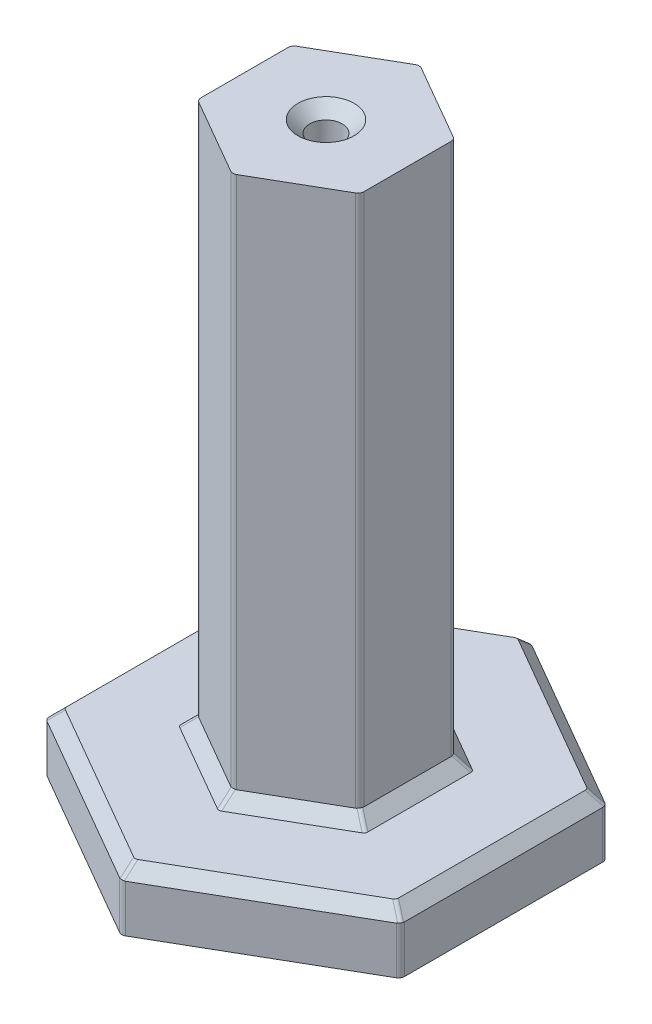
from build123d import *

# Parameters (mm, degrees)
BOSS_EXTRUDE1_DEPTH = 51
BOSS_EXTRUDE2_DEPTH = 5
SKETCH5_R           = 1.375
CUT_EXTRUDE2_DEPTH  = 15
CHAMFER1_SIZE       = 1
FILLET2_R           = 0.5


with BuildPart() as part:
    # Sketch2 → Boss-Extrude1 (new body)
    with BuildSketch(Plane(origin=(0, 0, 0), x_dir=(1, 0, 0), z_dir=(0, 1, 0))):
        Polygon((-6.875, 3.969283101), (-6.875, -3.969283101), (0, -7.938566201), (6.875, -3.969283101), (6.875, 3.969283101), (0, 7.938566201), align=None)
    extrude(amount=BOSS_EXTRUDE1_DEPTH)

    # Sketch2<3> → Boss-Extrude2 (add)
    with BuildSketch(Plane(origin=(0, 0, 0), x_dir=(1, 0, 0), z_dir=(0, 1, 0))):
        Polygon((0, -17.320508076), (15, -8.660254038), (15, 8.660254038), (0, 17.320508076), (-15, 8.660254038), (-15, -8.660254038), align=None)
        Polygon((0, -7.938566201), (6.875, -3.969283101), (6.875, 3.969283101), (0, 7.938566201), (-6.875, 3.969283101), (-6.875, -3.969283101), align=None, mode=Mode.SUBTRACT)
    extrude(amount=BOSS_EXTRUDE2_DEPTH)

    # Sketch5 → Cut-Extrude2 (cut)
    with BuildSketch(Plane(origin=(0, 51, 0), x_dir=(1, 0, 0), z_dir=(0, 1, 0))):
        with Locations(Location((0, 0, 0), (0, 0, 270))):
            Circle(SKETCH5_R)
    extrude(amount=-CUT_EXTRUDE2_DEPTH, mode=Mode.SUBTRACT)

    # Chamfer1
    chamfer1_edges = [part.edges().sort_by_distance(p)[0] for p in [
        (-7.5, 5, 12.990381057),
        (7.5, 5, 12.990381057),
        (15, 5, 0),
        (7.5, 5, -12.990381057),
        (-7.5, 5, -12.990381057),
        (-15, 5, 0),
        (-3.4375, 5, 5.953924651),
        (3.4375, 5, 5.953924651),
        (6.875, 5, 0),
        (3.4375, 5, -5.953924651),
        (-3.4375, 5, -5.953924651),
        (-6.875, 5, 0),
        (0, 51, -1.375),
    ]]
    chamfer(chamfer1_edges, length=CHAMFER1_SIZE)

    # Fillet2
    # the kernel refuses this fillet: 0.5 mm, written as the material it takes off along each edge
    with BuildSketch(Plane(origin=(-6.875, 5.278312164, -3.969283101), x_dir=(0, 0, 1), z_dir=(0, 1, 0))) as fillet2_piece_1_section:
        with BuildLine():
            CenterArc((FILLET2_R * 0.57735026919, FILLET2_R), FILLET2_R, 210, 60)
            Line((-FILLET2_R * 0.288675134595, FILLET2_R * 0.5), (0, 0))
            Line((0, 0), (FILLET2_R * 0.57735026919, 0))
        make_face()
    fillet2_piece_1 = extrude(amount=46.443375673, mode=Mode.PRIVATE)
    fillet2_piece_1 = split(fillet2_piece_1, bisect_by=Plane(origin=(-6.770495105, 6.104504895, -4.042866803), z_dir=(0.7071067811865476, -0.7071067811865476, -7.358336291174564e-15)), keep=Keep.TOP, mode=Mode.PRIVATE)
    fillet2_piece_1 = split(fillet2_piece_1, bisect_by=Plane(origin=(-6.720790333, 6.038231864, -4.014169739), z_dir=(-0.3535533905932788, 0.7071067811865475, -0.6123724356957917)), keep=Keep.TOP, mode=Mode.PRIVATE)
    add(fillet2_piece_1, mode=Mode.SUBTRACT)
    with BuildSketch(Plane(origin=(-6.875, 5.278312164, -3.969283101), x_dir=(0, 0, 1), z_dir=(0, 1, 0))) as fillet2_piece_2_section:
        with BuildLine():
            CenterArc((FILLET2_R * 0.57735026919, FILLET2_R), FILLET2_R, 210, 60)
            Line((-FILLET2_R * 0.288675134595, FILLET2_R * 0.5), (0, 0))
            Line((0, 0), (FILLET2_R * 0.57735026919, 0))
        make_face()
    fillet2_piece_2 = extrude(amount=46.443375673, mode=Mode.PRIVATE)
    fillet2_piece_2 = split(fillet2_piece_2, bisect_by=Plane(origin=(-6.836768136, 6.038231864, -3.813290292), z_dir=(-0.7071067811865476, 0.7071067811865476, 7.358336291174564e-15)), keep=Keep.TOP, mode=Mode.PRIVATE)
    fillet2_piece_2 = split(fillet2_piece_2, bisect_by=Plane(origin=(-6.886472909, 6.104504895, -3.841987356), z_dir=(0.3535533905932788, -0.7071067811865475, 0.6123724356957917)), keep=Keep.TOP, mode=Mode.PRIVATE)
    add(fillet2_piece_2, mode=Mode.SUBTRACT)
    with BuildSketch(Plane(origin=(-6.875, 5.278312164, -3.969283101), x_dir=(0, 0, 1), z_dir=(0, 1, 0))) as fillet2_piece_3_section:
        with BuildLine():
            CenterArc((FILLET2_R * 0.57735026919, FILLET2_R), FILLET2_R, 210, 60)
            Line((-FILLET2_R * 0.288675134595, FILLET2_R * 0.5), (0, 0))
            Line((0, 0), (FILLET2_R * 0.57735026919, 0))
        make_face()
    fillet2_piece_3 = extrude(amount=46.443375673, mode=Mode.PRIVATE)
    fillet2_piece_3 = split(fillet2_piece_3, bisect_by=Plane(origin=(4.606391484, 17.481391484, -3.938028383), z_dir=(-0.7071067811865476, 0.7071067811865476, 7.358336291174564e-15)), keep=Keep.TOP, mode=Mode.PRIVATE)
    fillet2_piece_3 = split(fillet2_piece_3, bisect_by=Plane(origin=(-1.107236878, 17.481391484, 5.958266237), z_dir=(-0.3535533905932788, 0.7071067811865475, -0.6123724356957917)), keep=Keep.TOP, mode=Mode.PRIVATE)
    add(fillet2_piece_3, mode=Mode.SUBTRACT)
    with BuildSketch(Plane(origin=(0, 5.278312164, -7.938566201), x_dir=(-0.8660254037844356, 0, 0.5000000000000054), z_dir=(0, 1, 0))) as fillet2_piece_4_section:
        with BuildLine():
            CenterArc((FILLET2_R * 0.57735026919, FILLET2_R), FILLET2_R, 210, 60)
            Line((-FILLET2_R * 0.288675134595, FILLET2_R * 0.5), (0, 0))
            Line((0, 0), (FILLET2_R * 0.57735026919, 0))
        make_face()
    fillet2_piece_4 = extrude(amount=46.443375673, mode=Mode.PRIVATE)
    fillet2_piece_4 = split(fillet2_piece_4, bisect_by=Plane(origin=(0.115977803, 6.104504895, -7.884854159), z_dir=(0.3535533905932788, -0.7071067811865475, 0.6123724356957917)), keep=Keep.TOP, mode=Mode.PRIVATE)
    fillet2_piece_4 = split(fillet2_piece_4, bisect_by=Plane(origin=(0.115977803, 6.038231864, -7.827460031), z_dir=(0.35355339059327007, 0.7071067811865476, -0.6123724356957966)), keep=Keep.TOP, mode=Mode.PRIVATE)
    add(fillet2_piece_4, mode=Mode.SUBTRACT)
    with BuildSketch(Plane(origin=(0, 5.278312164, -7.938566201), x_dir=(-0.8660254037844356, 0, 0.5000000000000054), z_dir=(0, 1, 0))) as fillet2_piece_5_section:
        with BuildLine():
            CenterArc((FILLET2_R * 0.57735026919, FILLET2_R), FILLET2_R, 210, 60)
            Line((-FILLET2_R * 0.288675134595, FILLET2_R * 0.5), (0, 0))
            Line((0, 0), (FILLET2_R * 0.57735026919, 0))
        make_face()
    fillet2_piece_5 = extrude(amount=46.443375673, mode=Mode.PRIVATE)
    fillet2_piece_5 = split(fillet2_piece_5, bisect_by=Plane(origin=(-0.115977803, 6.038231864, -7.827460031), z_dir=(-0.3535533905932788, 0.7071067811865475, -0.6123724356957917)), keep=Keep.TOP, mode=Mode.PRIVATE)
    fillet2_piece_5 = split(fillet2_piece_5, bisect_by=Plane(origin=(-0.115977803, 6.104504895, -7.884854159), z_dir=(-0.35355339059327007, -0.7071067811865476, 0.6123724356957966)), keep=Keep.TOP, mode=Mode.PRIVATE)
    add(fillet2_piece_5, mode=Mode.SUBTRACT)
    with BuildSketch(Plane(origin=(0, 5.278312164, -7.938566201), x_dir=(-0.8660254037844356, 0, 0.5000000000000054), z_dir=(0, 1, 0))) as fillet2_piece_6_section:
        with BuildLine():
            CenterArc((FILLET2_R * 0.57735026919, FILLET2_R), FILLET2_R, 210, 60)
            Line((-FILLET2_R * 0.288675134595, FILLET2_R * 0.5), (0, 0))
            Line((0, 0), (FILLET2_R * 0.57735026919, 0))
        make_face()
    fillet2_piece_6 = extrude(amount=46.443375673, mode=Mode.PRIVATE)
    fillet2_piece_6 = split(fillet2_piece_6, bisect_by=Plane(origin=(5.713628362, 17.481391484, 2.020237854), z_dir=(-0.3535533905932788, 0.7071067811865475, -0.6123724356957917)), keep=Keep.TOP, mode=Mode.PRIVATE)
    fillet2_piece_6 = split(fillet2_piece_6, bisect_by=Plane(origin=(-5.713628362, 17.481391484, 2.020237854), z_dir=(0.35355339059327007, 0.7071067811865476, -0.6123724356957966)), keep=Keep.TOP, mode=Mode.PRIVATE)
    add(fillet2_piece_6, mode=Mode.SUBTRACT)
    with BuildSketch(Plane(origin=(6.875, 5.278312164, -3.969283101), x_dir=(-0.866025403784442, 0, -0.4999999999999941), z_dir=(0, 1, 0))) as fillet2_piece_7_section:
        with BuildLine():
            CenterArc((FILLET2_R * 0.57735026919, FILLET2_R), FILLET2_R, 210, 60)
            Line((-FILLET2_R * 0.288675134595, FILLET2_R * 0.5), (0, 0))
            Line((0, 0), (FILLET2_R * 0.57735026919, 0))
        make_face()
    fillet2_piece_7 = extrude(amount=46.443375673, mode=Mode.PRIVATE)
    fillet2_piece_7 = split(fillet2_piece_7, bisect_by=Plane(origin=(6.886472909, 6.104504895, -3.841987356), z_dir=(-0.35355339059327007, -0.7071067811865476, 0.6123724356957966)), keep=Keep.TOP, mode=Mode.PRIVATE)
    fillet2_piece_7 = split(fillet2_piece_7, bisect_by=Plane(origin=(6.836768136, 6.038231864, -3.813290292), z_dir=(0.7071067811865476, 0.7071067811865476, -2.4667946423747115e-15)), keep=Keep.TOP, mode=Mode.PRIVATE)
    add(fillet2_piece_7, mode=Mode.SUBTRACT)
    with BuildSketch(Plane(origin=(6.875, 5.278312164, -3.969283101), x_dir=(-0.866025403784442, 0, -0.4999999999999941), z_dir=(0, 1, 0))) as fillet2_piece_8_section:
        with BuildLine():
            CenterArc((FILLET2_R * 0.57735026919, FILLET2_R), FILLET2_R, 210, 60)
            Line((-FILLET2_R * 0.288675134595, FILLET2_R * 0.5), (0, 0))
            Line((0, 0), (FILLET2_R * 0.57735026919, 0))
        make_face()
    fillet2_piece_8 = extrude(amount=46.443375673, mode=Mode.PRIVATE)
    fillet2_piece_8 = split(fillet2_piece_8, bisect_by=Plane(origin=(6.720790333, 6.038231864, -4.014169739), z_dir=(0.35355339059327007, 0.7071067811865476, -0.6123724356957966)), keep=Keep.TOP, mode=Mode.PRIVATE)
    fillet2_piece_8 = split(fillet2_piece_8, bisect_by=Plane(origin=(6.770495105, 6.104504895, -4.042866803), z_dir=(-0.7071067811865476, -0.7071067811865476, 2.4667946423747115e-15)), keep=Keep.TOP, mode=Mode.PRIVATE)
    add(fillet2_piece_8, mode=Mode.SUBTRACT)
    with BuildSketch(Plane(origin=(6.875, 5.278312164, -3.969283101), x_dir=(-0.866025403784442, 0, -0.4999999999999941), z_dir=(0, 1, 0))) as fillet2_piece_9_section:
        with BuildLine():
            CenterArc((FILLET2_R * 0.57735026919, FILLET2_R), FILLET2_R, 210, 60)
            Line((-FILLET2_R * 0.288675134595, FILLET2_R * 0.5), (0, 0))
            Line((0, 0), (FILLET2_R * 0.57735026919, 0))
        make_face()
    fillet2_piece_9 = extrude(amount=46.443375673, mode=Mode.PRIVATE)
    fillet2_piece_9 = split(fillet2_piece_9, bisect_by=Plane(origin=(1.107236878, 17.481391484, 5.958266237), z_dir=(0.35355339059327007, 0.7071067811865476, -0.6123724356957966)), keep=Keep.TOP, mode=Mode.PRIVATE)
    fillet2_piece_9 = split(fillet2_piece_9, bisect_by=Plane(origin=(-4.606391484, 17.481391484, -3.938028383), z_dir=(0.7071067811865476, 0.7071067811865476, -2.4667946423747115e-15)), keep=Keep.TOP, mode=Mode.PRIVATE)
    add(fillet2_piece_9, mode=Mode.SUBTRACT)
    with BuildSketch(Plane(origin=(6.875, 5.278312164, 3.969283101), x_dir=(-0.8660254037844378, 0, 0.5000000000000014), z_dir=(0, 1, 0))) as fillet2_piece_10_section:
        with BuildLine():
            CenterArc((FILLET2_R * 0.57735026919, -FILLET2_R), FILLET2_R, 90, 60)
            Line((-FILLET2_R * 0.288675134595, -FILLET2_R * 0.5), (0, 0))
            Line((0, 0), (FILLET2_R * 0.57735026919, 0))
        make_face()
    fillet2_piece_10 = extrude(amount=46.443375673, mode=Mode.PRIVATE)
    fillet2_piece_10 = split(fillet2_piece_10, bisect_by=Plane(origin=(6.886472909, 6.104504895, 3.841987356), z_dir=(-0.3535533905932744, -0.7071067811865475, -0.6123724356957944)), keep=Keep.TOP, mode=Mode.PRIVATE)
    fillet2_piece_10 = split(fillet2_piece_10, bisect_by=Plane(origin=(6.836768136, 6.038231864, 3.813290292), z_dir=(0.7071067811865476, 0.7071067811865476, -2.4667946423747115e-15)), keep=Keep.TOP, mode=Mode.PRIVATE)
    add(fillet2_piece_10, mode=Mode.SUBTRACT)
    with BuildSketch(Plane(origin=(6.875, 5.278312164, 3.969283101), x_dir=(-0.8660254037844378, 0, 0.5000000000000014), z_dir=(0, 1, 0))) as fillet2_piece_11_section:
        with BuildLine():
            CenterArc((FILLET2_R * 0.57735026919, -FILLET2_R), FILLET2_R, 90, 60)
            Line((-FILLET2_R * 0.288675134595, -FILLET2_R * 0.5), (0, 0))
            Line((0, 0), (FILLET2_R * 0.57735026919, 0))
        make_face()
    fillet2_piece_11 = extrude(amount=46.443375673, mode=Mode.PRIVATE)
    fillet2_piece_11 = split(fillet2_piece_11, bisect_by=Plane(origin=(6.720790333, 6.038231864, 4.014169739), z_dir=(0.3535533905932744, 0.7071067811865475, 0.6123724356957944)), keep=Keep.TOP, mode=Mode.PRIVATE)
    fillet2_piece_11 = split(fillet2_piece_11, bisect_by=Plane(origin=(6.770495105, 6.104504895, 4.042866803), z_dir=(-0.7071067811865476, -0.7071067811865476, 2.4667946423747115e-15)), keep=Keep.TOP, mode=Mode.PRIVATE)
    add(fillet2_piece_11, mode=Mode.SUBTRACT)
    with BuildSketch(Plane(origin=(6.875, 5.278312164, 3.969283101), x_dir=(-0.8660254037844378, 0, 0.5000000000000014), z_dir=(0, 1, 0))) as fillet2_piece_12_section:
        with BuildLine():
            CenterArc((FILLET2_R * 0.57735026919, -FILLET2_R), FILLET2_R, 90, 60)
            Line((-FILLET2_R * 0.288675134595, -FILLET2_R * 0.5), (0, 0))
            Line((0, 0), (FILLET2_R * 0.57735026919, 0))
        make_face()
    fillet2_piece_12 = extrude(amount=46.443375673, mode=Mode.PRIVATE)
    fillet2_piece_12 = split(fillet2_piece_12, bisect_by=Plane(origin=(1.107236878, 17.481391484, -5.958266237), z_dir=(0.3535533905932744, 0.7071067811865475, 0.6123724356957944)), keep=Keep.TOP, mode=Mode.PRIVATE)
    fillet2_piece_12 = split(fillet2_piece_12, bisect_by=Plane(origin=(-4.606391484, 17.481391484, 3.938028383), z_dir=(0.7071067811865476, 0.7071067811865476, -2.4667946423747115e-15)), keep=Keep.TOP, mode=Mode.PRIVATE)
    add(fillet2_piece_12, mode=Mode.SUBTRACT)
    with BuildSketch(Plane(origin=(0, 5.278312164, 7.938566201), x_dir=(-0.8660254037844413, 0, -0.4999999999999955), z_dir=(0, 1, 0))) as fillet2_piece_13_section:
        with BuildLine():
            CenterArc((FILLET2_R * 0.57735026919, -FILLET2_R), FILLET2_R, 90, 60)
            Line((-FILLET2_R * 0.288675134595, -FILLET2_R * 0.5), (0, 0))
            Line((0, 0), (FILLET2_R * 0.57735026919, 0))
        make_face()
    fillet2_piece_13 = extrude(amount=46.443375673, mode=Mode.PRIVATE)
    fillet2_piece_13 = split(fillet2_piece_13, bisect_by=Plane(origin=(0.115977803, 6.104504895, 7.884854159), z_dir=(0.3535533905932701, -0.7071067811865477, -0.6123724356957966)), keep=Keep.TOP, mode=Mode.PRIVATE)
    fillet2_piece_13 = split(fillet2_piece_13, bisect_by=Plane(origin=(0.115977803, 6.038231864, 7.827460031), z_dir=(0.3535533905932744, 0.7071067811865475, 0.6123724356957944)), keep=Keep.TOP, mode=Mode.PRIVATE)
    add(fillet2_piece_13, mode=Mode.SUBTRACT)
    with BuildSketch(Plane(origin=(0, 5.278312164, 7.938566201), x_dir=(-0.8660254037844413, 0, -0.4999999999999955), z_dir=(0, 1, 0))) as fillet2_piece_14_section:
        with BuildLine():
            CenterArc((FILLET2_R * 0.57735026919, -FILLET2_R), FILLET2_R, 90, 60)
            Line((-FILLET2_R * 0.288675134595, -FILLET2_R * 0.5), (0, 0))
            Line((0, 0), (FILLET2_R * 0.57735026919, 0))
        make_face()
    fillet2_piece_14 = extrude(amount=46.443375673, mode=Mode.PRIVATE)
    fillet2_piece_14 = split(fillet2_piece_14, bisect_by=Plane(origin=(-0.115977803, 6.038231864, 7.827460031), z_dir=(-0.3535533905932701, 0.7071067811865477, 0.6123724356957966)), keep=Keep.TOP, mode=Mode.PRIVATE)
    fillet2_piece_14 = split(fillet2_piece_14, bisect_by=Plane(origin=(-0.115977803, 6.104504895, 7.884854159), z_dir=(-0.3535533905932744, -0.7071067811865475, -0.6123724356957944)), keep=Keep.TOP, mode=Mode.PRIVATE)
    add(fillet2_piece_14, mode=Mode.SUBTRACT)
    with BuildSketch(Plane(origin=(0, 5.278312164, 7.938566201), x_dir=(-0.8660254037844413, 0, -0.4999999999999955), z_dir=(0, 1, 0))) as fillet2_piece_15_section:
        with BuildLine():
            CenterArc((FILLET2_R * 0.57735026919, -FILLET2_R), FILLET2_R, 90, 60)
            Line((-FILLET2_R * 0.288675134595, -FILLET2_R * 0.5), (0, 0))
            Line((0, 0), (FILLET2_R * 0.57735026919, 0))
        make_face()
    fillet2_piece_15 = extrude(amount=46.443375673, mode=Mode.PRIVATE)
    fillet2_piece_15 = split(fillet2_piece_15, bisect_by=Plane(origin=(5.713628362, 17.481391484, -2.020237854), z_dir=(-0.3535533905932701, 0.7071067811865477, 0.6123724356957966)), keep=Keep.TOP, mode=Mode.PRIVATE)
    fillet2_piece_15 = split(fillet2_piece_15, bisect_by=Plane(origin=(-5.713628362, 17.481391484, -2.020237854), z_dir=(0.3535533905932744, 0.7071067811865475, 0.6123724356957944)), keep=Keep.TOP, mode=Mode.PRIVATE)
    add(fillet2_piece_15, mode=Mode.SUBTRACT)
    with BuildSketch(Plane(origin=(-6.875, 5.278312164, 3.969283101), x_dir=(0, 0, -1), z_dir=(0, 1, 0))) as fillet2_piece_16_section:
        with BuildLine():
            CenterArc((FILLET2_R * 0.57735026919, -FILLET2_R), FILLET2_R, 90, 60)
            Line((-FILLET2_R * 0.288675134595, -FILLET2_R * 0.5), (0, 0))
            Line((0, 0), (FILLET2_R * 0.57735026919, 0))
        make_face()
    fillet2_piece_16 = extrude(amount=46.443375673, mode=Mode.PRIVATE)
    fillet2_piece_16 = split(fillet2_piece_16, bisect_by=Plane(origin=(-6.770495105, 6.104504895, 4.042866803), z_dir=(0.7071067811865476, -0.7071067811865476, -7.358336291174564e-15)), keep=Keep.TOP, mode=Mode.PRIVATE)
    fillet2_piece_16 = split(fillet2_piece_16, bisect_by=Plane(origin=(-6.720790333, 6.038231864, 4.014169739), z_dir=(-0.3535533905932701, 0.7071067811865477, 0.6123724356957966)), keep=Keep.TOP, mode=Mode.PRIVATE)
    add(fillet2_piece_16, mode=Mode.SUBTRACT)
    with BuildSketch(Plane(origin=(-6.875, 5.278312164, 3.969283101), x_dir=(0, 0, -1), z_dir=(0, 1, 0))) as fillet2_piece_17_section:
        with BuildLine():
            CenterArc((FILLET2_R * 0.57735026919, -FILLET2_R), FILLET2_R, 90, 60)
            Line((-FILLET2_R * 0.288675134595, -FILLET2_R * 0.5), (0, 0))
            Line((0, 0), (FILLET2_R * 0.57735026919, 0))
        make_face()
    fillet2_piece_17 = extrude(amount=46.443375673, mode=Mode.PRIVATE)
    fillet2_piece_17 = split(fillet2_piece_17, bisect_by=Plane(origin=(-6.836768136, 6.038231864, 3.813290292), z_dir=(-0.7071067811865476, 0.7071067811865476, 7.358336291174564e-15)), keep=Keep.TOP, mode=Mode.PRIVATE)
    fillet2_piece_17 = split(fillet2_piece_17, bisect_by=Plane(origin=(-6.886472909, 6.104504895, 3.841987356), z_dir=(0.3535533905932701, -0.7071067811865477, -0.6123724356957966)), keep=Keep.TOP, mode=Mode.PRIVATE)
    add(fillet2_piece_17, mode=Mode.SUBTRACT)
    with BuildSketch(Plane(origin=(-6.875, 5.278312164, 3.969283101), x_dir=(0, 0, -1), z_dir=(0, 1, 0))) as fillet2_piece_18_section:
        with BuildLine():
            CenterArc((FILLET2_R * 0.57735026919, -FILLET2_R), FILLET2_R, 90, 60)
            Line((-FILLET2_R * 0.288675134595, -FILLET2_R * 0.5), (0, 0))
            Line((0, 0), (FILLET2_R * 0.57735026919, 0))
        make_face()
    fillet2_piece_18 = extrude(amount=46.443375673, mode=Mode.PRIVATE)
    fillet2_piece_18 = split(fillet2_piece_18, bisect_by=Plane(origin=(4.606391484, 17.481391484, 3.938028383), z_dir=(-0.7071067811865476, 0.7071067811865476, 7.358336291174564e-15)), keep=Keep.TOP, mode=Mode.PRIVATE)
    fillet2_piece_18 = split(fillet2_piece_18, bisect_by=Plane(origin=(-1.107236878, 17.481391484, -5.958266237), z_dir=(-0.3535533905932701, 0.7071067811865477, 0.6123724356957966)), keep=Keep.TOP, mode=Mode.PRIVATE)
    add(fillet2_piece_18, mode=Mode.SUBTRACT)
    with BuildSketch(Plane(origin=(-15, -0.721687836, 8.660254038), x_dir=(0.8660254037844382, 0, 0.5000000000000006), z_dir=(0, 1, 0)), Plane(origin=(-15, -0.721687836, -8.660254038), x_dir=(0, 0, 1), z_dir=(0, 1, 0)), Plane(origin=(0, -0.721687836, -17.320508076), x_dir=(-0.8660254037844393, 0, 0.4999999999999987), z_dir=(0, 1, 0))) as fillet2_piece_19:
        with BuildLine():
            CenterArc((FILLET2_R * 0.57735026919, FILLET2_R), FILLET2_R, 210, 60)
            Line((-FILLET2_R * 0.288675134595, FILLET2_R * 0.5), (0, 0))
            Line((0, 0), (FILLET2_R * 0.57735026919, 0))
        make_face()
    extrude(amount=5.443375673, mode=Mode.SUBTRACT)
    with BuildSketch(Plane(origin=(15, -0.721687836, -8.660254038), x_dir=(0, 0, 1), z_dir=(0, 1, 0)), Plane(origin=(15, -0.721687836, 8.660254038), x_dir=(-0.8660254037844382, 0, 0.5000000000000006), z_dir=(0, 1, 0)), Plane(origin=(0, -0.721687836, 17.320508076), x_dir=(-0.8660254037844393, 0, -0.4999999999999987), z_dir=(0, 1, 0))) as fillet2_piece_20:
        with BuildLine():
            CenterArc((FILLET2_R * 0.57735026919, -FILLET2_R), FILLET2_R, 90, 60)
            Line((-FILLET2_R * 0.288675134595, -FILLET2_R * 0.5), (0, 0))
            Line((0, 0), (FILLET2_R * 0.57735026919, 0))
        make_face()
    extrude(amount=5.443375673, mode=Mode.SUBTRACT)
    with BuildSketch(Plane(origin=(-8.184294787, 4.690705213, 4.725204798), x_dir=(-0.26726124191243283, -0.26726124191242345, -0.9258200997725493), z_dir=(0.6546536707079736, 0.6546536707079776, -0.3779644730092325))) as fillet2_piece_21_section:
        with BuildLine():
            CenterArc((FILLET2_R * 0.377964473009, -FILLET2_R), FILLET2_R, 90, 41.409622109)
            Line((-FILLET2_R * 0.283473354757, -FILLET2_R * 0.25), (0, 0))
            Line((0, 0), (FILLET2_R * 0.377964473009, 0))
        make_face()
    fillet2_piece_21 = extrude(amount=2.472436414, mode=Mode.PRIVATE)
    fillet2_piece_21 = split(fillet2_piece_21, bisect_by=Plane(origin=(-6.875, 5.466076013, 4.256817747), z_dir=(-1, 0, 0)), keep=Keep.TOP, mode=Mode.PRIVATE)
    fillet2_piece_21 = split(fillet2_piece_21, bisect_by=Plane(origin=(-7.124012308, 5.466076013, 3.825515778), z_dir=(-0.4999999999999949, 0, 0.8660254037844416)), keep=Keep.TOP, mode=Mode.PRIVATE)
    fillet2_piece_21 = split(fillet2_piece_21, bisect_by=Plane(origin=(-7.373024616, 5, 4.256817747), z_dir=(0, 1, 0)), keep=Keep.TOP, mode=Mode.PRIVATE)
    add(fillet2_piece_21, mode=Mode.SUBTRACT)
    with BuildSketch(Plane(origin=(-8.184294787, 4.690705213, 4.725204798), x_dir=(-0.26726124191243283, -0.26726124191242345, -0.9258200997725493), z_dir=(0.6546536707079736, 0.6546536707079776, -0.3779644730092325))) as fillet2_piece_22_section:
        with BuildLine():
            CenterArc((FILLET2_R * 0.377964473009, -FILLET2_R), FILLET2_R, 90, 41.409622109)
            Line((-FILLET2_R * 0.283473354757, -FILLET2_R * 0.25), (0, 0))
            Line((0, 0), (FILLET2_R * 0.377964473009, 0))
        make_face()
    fillet2_piece_22 = extrude(amount=2.472436414, mode=Mode.PRIVATE)
    fillet2_piece_22 = split(fillet2_piece_22, bisect_by=Plane(origin=(-6.875, 5.950234489, 4.057810547), z_dir=(1, 0, 0)), keep=Keep.TOP, mode=Mode.PRIVATE)
    fillet2_piece_22 = split(fillet2_piece_22, bisect_by=Plane(origin=(-6.79833298, 5.950234489, 4.013546825), z_dir=(-0.4999999999999949, 0, 0.8660254037844416)), keep=Keep.TOP, mode=Mode.PRIVATE)
    add(fillet2_piece_22, mode=Mode.SUBTRACT)
    with BuildSketch(Plane(origin=(-8.184294787, 4.690705213, 4.725204798), x_dir=(-0.26726124191243283, -0.26726124191242345, -0.9258200997725493), z_dir=(0.6546536707079736, 0.6546536707079776, -0.3779644730092325))) as fillet2_piece_23_section:
        with BuildLine():
            CenterArc((FILLET2_R * 0.377964473009, -FILLET2_R), FILLET2_R, 90, 41.409622109)
            Line((-FILLET2_R * 0.283473354757, -FILLET2_R * 0.25), (0, 0))
            Line((0, 0), (FILLET2_R * 0.377964473009, 0))
        make_face()
    fillet2_piece_23 = extrude(amount=2.472436414, mode=Mode.PRIVATE)
    fillet2_piece_23 = split(fillet2_piece_23, bisect_by=Plane(origin=(-6.875, 5.950234489, 3.880755652), z_dir=(-1, 0, 0)), keep=Keep.TOP, mode=Mode.PRIVATE)
    fillet2_piece_23 = split(fillet2_piece_23, bisect_by=Plane(origin=(-6.951667017, 5.950234489, 3.925019378), z_dir=(0.4999999999999949, 0, -0.8660254037844416)), keep=Keep.TOP, mode=Mode.PRIVATE)
    add(fillet2_piece_23, mode=Mode.SUBTRACT)
    with BuildSketch(Plane(origin=(-8.184294787, 4.690705213, -4.725204798), x_dir=(-0.2672612419124129, -0.267261241912427, 0.925820099772554), z_dir=(0.654653670707981, 0.6546536707079771, 0.37796447300922104))) as fillet2_piece_24_section:
        with BuildLine():
            CenterArc((FILLET2_R * 0.377964473009, FILLET2_R), FILLET2_R, 228.590377891, 41.409622109)
            Line((-FILLET2_R * 0.283473354757, FILLET2_R * 0.25), (0, 0))
            Line((0, 0), (FILLET2_R * 0.377964473009, 0))
        make_face()
    fillet2_piece_24 = extrude(amount=2.472436414, mode=Mode.PRIVATE)
    fillet2_piece_24 = split(fillet2_piece_24, bisect_by=Plane(origin=(-6.875, 5.466076013, -4.256817747), z_dir=(-1, 0, 0)), keep=Keep.TOP, mode=Mode.PRIVATE)
    fillet2_piece_24 = split(fillet2_piece_24, bisect_by=Plane(origin=(-7.373024616, 5, -4.256817747), z_dir=(0, 1, 0)), keep=Keep.TOP, mode=Mode.PRIVATE)
    fillet2_piece_24 = split(fillet2_piece_24, bisect_by=Plane(origin=(-7.124012308, 5.466076013, -3.825515778), z_dir=(-0.500000000000007, 0, -0.8660254037844347)), keep=Keep.TOP, mode=Mode.PRIVATE)
    add(fillet2_piece_24, mode=Mode.SUBTRACT)
    with BuildSketch(Plane(origin=(-8.184294787, 4.690705213, -4.725204798), x_dir=(-0.2672612419124129, -0.267261241912427, 0.925820099772554), z_dir=(0.654653670707981, 0.6546536707079771, 0.37796447300922104))) as fillet2_piece_25_section:
        with BuildLine():
            CenterArc((FILLET2_R * 0.377964473009, FILLET2_R), FILLET2_R, 228.590377891, 41.409622109)
            Line((-FILLET2_R * 0.283473354757, FILLET2_R * 0.25), (0, 0))
            Line((0, 0), (FILLET2_R * 0.377964473009, 0))
        make_face()
    fillet2_piece_25 = extrude(amount=2.472436414, mode=Mode.PRIVATE)
    fillet2_piece_25 = split(fillet2_piece_25, bisect_by=Plane(origin=(-6.875, 5.950234489, -4.057810547), z_dir=(1, 0, 0)), keep=Keep.TOP, mode=Mode.PRIVATE)
    fillet2_piece_25 = split(fillet2_piece_25, bisect_by=Plane(origin=(-6.79833298, 5.950234489, -4.013546825), z_dir=(-0.500000000000007, 0, -0.8660254037844347)), keep=Keep.TOP, mode=Mode.PRIVATE)
    add(fillet2_piece_25, mode=Mode.SUBTRACT)
    with BuildSketch(Plane(origin=(-8.184294787, 4.690705213, -4.725204798), x_dir=(-0.2672612419124129, -0.267261241912427, 0.925820099772554), z_dir=(0.654653670707981, 0.6546536707079771, 0.37796447300922104))) as fillet2_piece_26_section:
        with BuildLine():
            CenterArc((FILLET2_R * 0.377964473009, FILLET2_R), FILLET2_R, 228.590377891, 41.409622109)
            Line((-FILLET2_R * 0.283473354757, FILLET2_R * 0.25), (0, 0))
            Line((0, 0), (FILLET2_R * 0.377964473009, 0))
        make_face()
    fillet2_piece_26 = extrude(amount=2.472436414, mode=Mode.PRIVATE)
    fillet2_piece_26 = split(fillet2_piece_26, bisect_by=Plane(origin=(-6.875, 5.950234489, -3.880755652), z_dir=(-1, 0, 0)), keep=Keep.TOP, mode=Mode.PRIVATE)
    fillet2_piece_26 = split(fillet2_piece_26, bisect_by=Plane(origin=(-6.951667017, 5.950234489, -3.925019378), z_dir=(0.500000000000007, 0, 0.8660254037844347)), keep=Keep.TOP, mode=Mode.PRIVATE)
    add(fillet2_piece_26, mode=Mode.SUBTRACT)
    with BuildSketch(Plane(origin=(0, 4.690705213, 9.450409597), x_dir=(-0.9354143466934874, -0.26726124191242123, -0.2314550249431329), z_dir=(-2.1820492742108273e-15, 0.6546536707079779, -0.7559289460184538))) as fillet2_piece_27_section:
        with BuildLine():
            CenterArc((FILLET2_R * 0.377964473009, -FILLET2_R), FILLET2_R, 90, 41.409622109)
            Line((-FILLET2_R * 0.283473354757, -FILLET2_R * 0.25), (0, 0))
            Line((0, 0), (FILLET2_R * 0.377964473009, 0))
        make_face()
    fillet2_piece_27 = extrude(amount=2.472436414, mode=Mode.PRIVATE)
    fillet2_piece_27 = split(fillet2_piece_27, bisect_by=Plane(origin=(0.249012308, 5.466076013, 8.082333524), z_dir=(-0.4999999999999949, 0, 0.8660254037844416)), keep=Keep.TOP, mode=Mode.PRIVATE)
    fillet2_piece_27 = split(fillet2_piece_27, bisect_by=Plane(origin=(-0.249012308, 5.466076013, 8.082333524), z_dir=(0.500000000000001, 0, 0.8660254037844382)), keep=Keep.TOP, mode=Mode.PRIVATE)
    fillet2_piece_27 = split(fillet2_piece_27, bisect_by=Plane(origin=(0, 5, 8.513635494), z_dir=(0, 1, 0)), keep=Keep.TOP, mode=Mode.PRIVATE)
    add(fillet2_piece_27, mode=Mode.SUBTRACT)
    with BuildSketch(Plane(origin=(0, 4.690705213, 9.450409597), x_dir=(-0.9354143466934874, -0.26726124191242123, -0.2314550249431329), z_dir=(-2.1820492742108273e-15, 0.6546536707079779, -0.7559289460184538))) as fillet2_piece_28_section:
        with BuildLine():
            CenterArc((FILLET2_R * 0.377964473009, -FILLET2_R), FILLET2_R, 90, 41.409622109)
            Line((-FILLET2_R * 0.283473354757, -FILLET2_R * 0.25), (0, 0))
            Line((0, 0), (FILLET2_R * 0.377964473009, 0))
        make_face()
    fillet2_piece_28 = extrude(amount=2.472436414, mode=Mode.PRIVATE)
    fillet2_piece_28 = split(fillet2_piece_28, bisect_by=Plane(origin=(0.076667017, 5.950234489, 7.982829924), z_dir=(0.4999999999999949, 0, -0.8660254037844416)), keep=Keep.TOP, mode=Mode.PRIVATE)
    fillet2_piece_28 = split(fillet2_piece_28, bisect_by=Plane(origin=(0.07666702, 5.950234489, 7.894302477), z_dir=(0.500000000000001, 0, 0.8660254037844382)), keep=Keep.TOP, mode=Mode.PRIVATE)
    add(fillet2_piece_28, mode=Mode.SUBTRACT)
    with BuildSketch(Plane(origin=(0, 4.690705213, 9.450409597), x_dir=(-0.9354143466934874, -0.26726124191242123, -0.2314550249431329), z_dir=(-2.1820492742108273e-15, 0.6546536707079779, -0.7559289460184538))) as fillet2_piece_29_section:
        with BuildLine():
            CenterArc((FILLET2_R * 0.377964473009, -FILLET2_R), FILLET2_R, 90, 41.409622109)
            Line((-FILLET2_R * 0.283473354757, -FILLET2_R * 0.25), (0, 0))
            Line((0, 0), (FILLET2_R * 0.377964473009, 0))
        make_face()
    fillet2_piece_29 = extrude(amount=2.472436414, mode=Mode.PRIVATE)
    fillet2_piece_29 = split(fillet2_piece_29, bisect_by=Plane(origin=(-0.07666702, 5.950234489, 7.894302477), z_dir=(-0.4999999999999949, 0, 0.8660254037844416)), keep=Keep.TOP, mode=Mode.PRIVATE)
    fillet2_piece_29 = split(fillet2_piece_29, bisect_by=Plane(origin=(-0.076667017, 5.950234489, 7.982829924), z_dir=(-0.500000000000001, 0, -0.8660254037844382)), keep=Keep.TOP, mode=Mode.PRIVATE)
    add(fillet2_piece_29, mode=Mode.SUBTRACT)
    with BuildSketch(Plane(origin=(0, 4.690705213, -9.450409597), x_dir=(-0.9354143466934844, -0.26726124191242323, 0.23145502494314288), z_dir=(4.951573353016852e-15, 0.654653670707977, 0.7559289460184546))) as fillet2_piece_30_section:
        with BuildLine():
            CenterArc((FILLET2_R * 0.377964473009, FILLET2_R), FILLET2_R, 228.590377891, 41.409622109)
            Line((-FILLET2_R * 0.283473354757, FILLET2_R * 0.25), (0, 0))
            Line((0, 0), (FILLET2_R * 0.377964473009, 0))
        make_face()
    fillet2_piece_30 = extrude(amount=2.472436414, mode=Mode.PRIVATE)
    fillet2_piece_30 = split(fillet2_piece_30, bisect_by=Plane(origin=(0.249012308, 5.466076013, -8.082333524), z_dir=(-0.500000000000007, 0, -0.8660254037844347)), keep=Keep.TOP, mode=Mode.PRIVATE)
    fillet2_piece_30 = split(fillet2_piece_30, bisect_by=Plane(origin=(0, 5, -8.513635494), z_dir=(0, 1, 0)), keep=Keep.TOP, mode=Mode.PRIVATE)
    fillet2_piece_30 = split(fillet2_piece_30, bisect_by=Plane(origin=(-0.249012308, 5.466076013, -8.082333524), z_dir=(0.4999999999999948, 0, -0.8660254037844417)), keep=Keep.TOP, mode=Mode.PRIVATE)
    add(fillet2_piece_30, mode=Mode.SUBTRACT)
    with BuildSketch(Plane(origin=(0, 4.690705213, -9.450409597), x_dir=(-0.9354143466934844, -0.26726124191242323, 0.23145502494314288), z_dir=(4.951573353016852e-15, 0.654653670707977, 0.7559289460184546))) as fillet2_piece_31_section:
        with BuildLine():
            CenterArc((FILLET2_R * 0.377964473009, FILLET2_R), FILLET2_R, 228.590377891, 41.409622109)
            Line((-FILLET2_R * 0.283473354757, FILLET2_R * 0.25), (0, 0))
            Line((0, 0), (FILLET2_R * 0.377964473009, 0))
        make_face()
    fillet2_piece_31 = extrude(amount=2.472436414, mode=Mode.PRIVATE)
    fillet2_piece_31 = split(fillet2_piece_31, bisect_by=Plane(origin=(0.076667017, 5.950234489, -7.982829924), z_dir=(0.500000000000007, 0, 0.8660254037844347)), keep=Keep.TOP, mode=Mode.PRIVATE)
    fillet2_piece_31 = split(fillet2_piece_31, bisect_by=Plane(origin=(0.07666702, 5.950234489, -7.894302477), z_dir=(0.4999999999999948, 0, -0.8660254037844417)), keep=Keep.TOP, mode=Mode.PRIVATE)
    add(fillet2_piece_31, mode=Mode.SUBTRACT)
    with BuildSketch(Plane(origin=(0, 4.690705213, -9.450409597), x_dir=(-0.9354143466934844, -0.26726124191242323, 0.23145502494314288), z_dir=(4.951573353016852e-15, 0.654653670707977, 0.7559289460184546))) as fillet2_piece_32_section:
        with BuildLine():
            CenterArc((FILLET2_R * 0.377964473009, FILLET2_R), FILLET2_R, 228.590377891, 41.409622109)
            Line((-FILLET2_R * 0.283473354757, FILLET2_R * 0.25), (0, 0))
            Line((0, 0), (FILLET2_R * 0.377964473009, 0))
        make_face()
    fillet2_piece_32 = extrude(amount=2.472436414, mode=Mode.PRIVATE)
    fillet2_piece_32 = split(fillet2_piece_32, bisect_by=Plane(origin=(-0.07666702, 5.950234489, -7.894302477), z_dir=(-0.500000000000007, 0, -0.8660254037844347)), keep=Keep.TOP, mode=Mode.PRIVATE)
    fillet2_piece_32 = split(fillet2_piece_32, bisect_by=Plane(origin=(-0.076667017, 5.950234489, -7.982829924), z_dir=(-0.4999999999999948, 0, 0.8660254037844417)), keep=Keep.TOP, mode=Mode.PRIVATE)
    add(fillet2_piece_32, mode=Mode.SUBTRACT)
    with BuildSketch(Plane(origin=(8.184294787, 4.690705213, 4.725204798), x_dir=(-0.6681531047810594, -0.2672612419124249, 0.694365074829415), z_dir=(-0.6546536707079783, 0.6546536707079771, -0.3779644730092256))) as fillet2_piece_33_section:
        with BuildLine():
            CenterArc((FILLET2_R * 0.377964473009, -FILLET2_R), FILLET2_R, 90, 41.409622109)
            Line((-FILLET2_R * 0.283473354757, -FILLET2_R * 0.25), (0, 0))
            Line((0, 0), (FILLET2_R * 0.377964473009, 0))
        make_face()
    fillet2_piece_33 = extrude(amount=2.472436414, mode=Mode.PRIVATE)
    fillet2_piece_33 = split(fillet2_piece_33, bisect_by=Plane(origin=(7.124012308, 5.466076013, 3.825515778), z_dir=(0.500000000000001, 0, 0.8660254037844382)), keep=Keep.TOP, mode=Mode.PRIVATE)
    fillet2_piece_33 = split(fillet2_piece_33, bisect_by=Plane(origin=(7.373024616, 5, 4.256817747), z_dir=(0, 1, 0)), keep=Keep.TOP, mode=Mode.PRIVATE)
    fillet2_piece_33 = split(fillet2_piece_33, bisect_by=Plane(origin=(6.875, 5.466076013, 4.256817747), z_dir=(1, 0, 0)), keep=Keep.TOP, mode=Mode.PRIVATE)
    add(fillet2_piece_33, mode=Mode.SUBTRACT)
    with BuildSketch(Plane(origin=(8.184294787, 4.690705213, 4.725204798), x_dir=(-0.6681531047810594, -0.2672612419124249, 0.694365074829415), z_dir=(-0.6546536707079783, 0.6546536707079771, -0.3779644730092256))) as fillet2_piece_34_section:
        with BuildLine():
            CenterArc((FILLET2_R * 0.377964473009, -FILLET2_R), FILLET2_R, 90, 41.409622109)
            Line((-FILLET2_R * 0.283473354757, -FILLET2_R * 0.25), (0, 0))
            Line((0, 0), (FILLET2_R * 0.377964473009, 0))
        make_face()
    fillet2_piece_34 = extrude(amount=2.472436414, mode=Mode.PRIVATE)
    fillet2_piece_34 = split(fillet2_piece_34, bisect_by=Plane(origin=(6.951667017, 5.950234489, 3.925019378), z_dir=(-0.500000000000001, 0, -0.8660254037844382)), keep=Keep.TOP, mode=Mode.PRIVATE)
    fillet2_piece_34 = split(fillet2_piece_34, bisect_by=Plane(origin=(6.875, 5.950234489, 3.880755652), z_dir=(1, 0, 0)), keep=Keep.TOP, mode=Mode.PRIVATE)
    add(fillet2_piece_34, mode=Mode.SUBTRACT)
    with BuildSketch(Plane(origin=(8.184294787, 4.690705213, 4.725204798), x_dir=(-0.6681531047810594, -0.2672612419124249, 0.694365074829415), z_dir=(-0.6546536707079783, 0.6546536707079771, -0.3779644730092256))) as fillet2_piece_35_section:
        with BuildLine():
            CenterArc((FILLET2_R * 0.377964473009, -FILLET2_R), FILLET2_R, 90, 41.409622109)
            Line((-FILLET2_R * 0.283473354757, -FILLET2_R * 0.25), (0, 0))
            Line((0, 0), (FILLET2_R * 0.377964473009, 0))
        make_face()
    fillet2_piece_35 = extrude(amount=2.472436414, mode=Mode.PRIVATE)
    fillet2_piece_35 = split(fillet2_piece_35, bisect_by=Plane(origin=(6.79833298, 5.950234489, 4.013546825), z_dir=(0.500000000000001, 0, 0.8660254037844382)), keep=Keep.TOP, mode=Mode.PRIVATE)
    fillet2_piece_35 = split(fillet2_piece_35, bisect_by=Plane(origin=(6.875, 5.950234489, 4.057810547), z_dir=(-1, 0, 0)), keep=Keep.TOP, mode=Mode.PRIVATE)
    add(fillet2_piece_35, mode=Mode.SUBTRACT)
    with BuildSketch(Plane(origin=(8.184294787, 4.690705213, -4.725204798), x_dir=(-0.668153104781066, -0.2672612419124279, -0.6943650748294075), z_dir=(-0.6546536707079755, 0.6546536707079769, 0.3779644730092306))) as fillet2_piece_36_section:
        with BuildLine():
            CenterArc((FILLET2_R * 0.377964473009, FILLET2_R), FILLET2_R, 228.590377891, 41.409622109)
            Line((-FILLET2_R * 0.283473354757, FILLET2_R * 0.25), (0, 0))
            Line((0, 0), (FILLET2_R * 0.377964473009, 0))
        make_face()
    fillet2_piece_36 = extrude(amount=2.472436414, mode=Mode.PRIVATE)
    fillet2_piece_36 = split(fillet2_piece_36, bisect_by=Plane(origin=(7.373024616, 5, -4.256817747), z_dir=(0, 1, 0)), keep=Keep.TOP, mode=Mode.PRIVATE)
    fillet2_piece_36 = split(fillet2_piece_36, bisect_by=Plane(origin=(7.124012308, 5.466076013, -3.825515778), z_dir=(0.4999999999999948, 0, -0.8660254037844417)), keep=Keep.TOP, mode=Mode.PRIVATE)
    fillet2_piece_36 = split(fillet2_piece_36, bisect_by=Plane(origin=(6.875, 5.466076013, -4.256817747), z_dir=(1, 0, 0)), keep=Keep.TOP, mode=Mode.PRIVATE)
    add(fillet2_piece_36, mode=Mode.SUBTRACT)
    with BuildSketch(Plane(origin=(8.184294787, 4.690705213, -4.725204798), x_dir=(-0.668153104781066, -0.2672612419124279, -0.6943650748294075), z_dir=(-0.6546536707079755, 0.6546536707079769, 0.3779644730092306))) as fillet2_piece_37_section:
        with BuildLine():
            CenterArc((FILLET2_R * 0.377964473009, FILLET2_R), FILLET2_R, 228.590377891, 41.409622109)
            Line((-FILLET2_R * 0.283473354757, FILLET2_R * 0.25), (0, 0))
            Line((0, 0), (FILLET2_R * 0.377964473009, 0))
        make_face()
    fillet2_piece_37 = extrude(amount=2.472436414, mode=Mode.PRIVATE)
    fillet2_piece_37 = split(fillet2_piece_37, bisect_by=Plane(origin=(6.951667017, 5.950234489, -3.925019378), z_dir=(-0.4999999999999948, 0, 0.8660254037844417)), keep=Keep.TOP, mode=Mode.PRIVATE)
    fillet2_piece_37 = split(fillet2_piece_37, bisect_by=Plane(origin=(6.875, 5.950234489, -3.880755652), z_dir=(1, 0, 0)), keep=Keep.TOP, mode=Mode.PRIVATE)
    add(fillet2_piece_37, mode=Mode.SUBTRACT)
    with BuildSketch(Plane(origin=(8.184294787, 4.690705213, -4.725204798), x_dir=(-0.668153104781066, -0.2672612419124279, -0.6943650748294075), z_dir=(-0.6546536707079755, 0.6546536707079769, 0.3779644730092306))) as fillet2_piece_38_section:
        with BuildLine():
            CenterArc((FILLET2_R * 0.377964473009, FILLET2_R), FILLET2_R, 228.590377891, 41.409622109)
            Line((-FILLET2_R * 0.283473354757, FILLET2_R * 0.25), (0, 0))
            Line((0, 0), (FILLET2_R * 0.377964473009, 0))
        make_face()
    fillet2_piece_38 = extrude(amount=2.472436414, mode=Mode.PRIVATE)
    fillet2_piece_38 = split(fillet2_piece_38, bisect_by=Plane(origin=(6.79833298, 5.950234489, -4.013546825), z_dir=(0.4999999999999948, 0, -0.8660254037844417)), keep=Keep.TOP, mode=Mode.PRIVATE)
    fillet2_piece_38 = split(fillet2_piece_38, bisect_by=Plane(origin=(6.875, 5.950234489, -4.057810547), z_dir=(-1, 0, 0)), keep=Keep.TOP, mode=Mode.PRIVATE)
    add(fillet2_piece_38, mode=Mode.SUBTRACT)
    with BuildSketch(Plane(origin=(13.690705213, 5.309294787, -7.90433234), x_dir=(0.2672612419124219, -0.2672612419124266, 0.9258200997725515), z_dir=(0.6546536707079772, -0.6546536707079772, -0.3779644730092271)), Plane(origin=(13.690705213, 5.309294787, 7.90433234), x_dir=(-0.6681531047810609, -0.2672612419124254, 0.6943650748294132), z_dir=(0.6546536707079774, -0.6546536707079774, 0.3779644730092266)), Plane(origin=(0, 5.309294787, 15.80866468), x_dir=(-0.9354143466934843, -0.26726124191242595, -0.23145502494314005), z_dir=(0, -0.6546536707079774, 0.7559289460184544))) as fillet2_piece_39:
        with BuildLine():
            CenterArc((FILLET2_R * 0.377964473009, FILLET2_R), FILLET2_R, 228.590377891, 41.409622109)
            Line((-FILLET2_R * 0.283473354757, FILLET2_R * 0.25), (0, 0))
            Line((0, 0), (FILLET2_R * 0.377964473009, 0))
        make_face()
    extrude(amount=2.472436414, mode=Mode.SUBTRACT)
    with BuildSketch(Plane(origin=(0, 5.309294787, -15.80866468), x_dir=(-0.9354143466934823, -0.2672612419124306, 0.2314550249431426), z_dir=(0, -0.6546536707079775, -0.7559289460184543)), Plane(origin=(-13.690705213, 5.309294787, -7.90433234), x_dir=(-0.2672612419124262, -0.26726124191242145, 0.9258200997725518), z_dir=(-0.6546536707079774, -0.6546536707079773, -0.3779644730092264)), Plane(origin=(-13.690705213, 5.309294787, 7.90433234), x_dir=(0.6681531047810614, -0.26726124191242584, 0.6943650748294126), z_dir=(-0.6546536707079773, -0.6546536707079773, 0.377964473009227))) as fillet2_piece_40:
        with BuildLine():
            CenterArc((FILLET2_R * 0.377964473009, -FILLET2_R), FILLET2_R, 90, 41.409622109)
            Line((-FILLET2_R * 0.283473354757, -FILLET2_R * 0.25), (0, 0))
            Line((0, 0), (FILLET2_R * 0.377964473009, 0))
        make_face()
    extrude(amount=2.472436414, mode=Mode.SUBTRACT)
    with BuildSketch(Plane(origin=(-6.875, 5.278312164, -3.969283101), x_dir=(0, 0, 1), z_dir=(0, 1, 0))) as fillet2_piece_41a_section:
        with BuildLine():
            CenterArc((FILLET2_R * 0.57735026919, FILLET2_R), FILLET2_R, 210, 60)
            Line((-FILLET2_R * 0.288675134595, FILLET2_R * 0.5), (0, 0))
            Line((0, 0), (FILLET2_R * 0.57735026919, 0))
        make_face()
    fillet2_piece_41a = extrude(amount=46.443375673, mode=Mode.PRIVATE)
    fillet2_piece_41a = split(fillet2_piece_41a, bisect_by=Plane(origin=(-7.02507839, 5.84992161, -3.938017852), z_dir=(0.7071067811865476, -0.7071067811865476, -7.358336291174564e-15)), keep=Keep.TOP, mode=Mode.PRIVATE)
    fillet2_piece_41a = split(fillet2_piece_41a, bisect_by=Plane(origin=(-6.922962695, 5.84992161, -4.114887424), z_dir=(0.3535533905932788, -0.7071067811865475, 0.6123724356957917)), keep=Keep.TOP, mode=Mode.PRIVATE)
    with BuildSketch(Plane(origin=(-8.184294787, 4.690705213, -4.725204798), x_dir=(-0.2672612419124129, -0.267261241912427, 0.925820099772554), z_dir=(0.654653670707981, 0.6546536707079771, 0.37796447300922104))) as fillet2_piece_41b_section:
        with BuildLine():
            CenterArc((FILLET2_R * 0.377964473009, FILLET2_R), FILLET2_R, 228.590377891, 41.409622109)
            Line((-FILLET2_R * 0.283473354757, FILLET2_R * 0.25), (0, 0))
            Line((0, 0), (FILLET2_R * 0.377964473009, 0))
        make_face()
    fillet2_piece_41b = extrude(amount=2.472436414, mode=Mode.PRIVATE)
    fillet2_piece_41b = split(fillet2_piece_41b, bisect_by=Plane(origin=(-6.875, 6.142182622, -3.866412279), z_dir=(1, 0, 0)), keep=Keep.TOP, mode=Mode.PRIVATE)
    fillet2_piece_41b = split(fillet2_piece_41b, bisect_by=Plane(origin=(-6.785911255, 6.142182622, -4.020718511), z_dir=(0.500000000000007, 0, 0.8660254037844347)), keep=Keep.TOP, mode=Mode.PRIVATE)
    fillet2_piece_41 = fillet2_piece_41a & fillet2_piece_41b
    add(fillet2_piece_41, mode=Mode.SUBTRACT)
    with BuildSketch(Plane(origin=(0, 5.278312164, -7.938566201), x_dir=(-0.8660254037844356, 0, 0.5000000000000054), z_dir=(0, 1, 0))) as fillet2_piece_42a_section:
        with BuildLine():
            CenterArc((FILLET2_R * 0.57735026919, FILLET2_R), FILLET2_R, 210, 60)
            Line((-FILLET2_R * 0.288675134595, FILLET2_R * 0.5), (0, 0))
            Line((0, 0), (FILLET2_R * 0.57735026919, 0))
        make_face()
    fillet2_piece_42a = extrude(amount=46.443375673, mode=Mode.PRIVATE)
    fillet2_piece_42a = split(fillet2_piece_42a, bisect_by=Plane(origin=(-0.102115695, 5.84992161, -8.052905275), z_dir=(0.3535533905932788, -0.7071067811865475, 0.6123724356957917)), keep=Keep.TOP, mode=Mode.PRIVATE)
    fillet2_piece_42a = split(fillet2_piece_42a, bisect_by=Plane(origin=(0.102115695, 5.84992161, -8.052905275), z_dir=(-0.35355339059327007, -0.7071067811865476, 0.6123724356957966)), keep=Keep.TOP, mode=Mode.PRIVATE)
    with BuildSketch(Plane(origin=(0, 4.690705213, -9.450409597), x_dir=(-0.9354143466934844, -0.26726124191242323, 0.23145502494314288), z_dir=(4.951573353016852e-15, 0.654653670707977, 0.7559289460184546))) as fillet2_piece_42b_section:
        with BuildLine():
            CenterArc((FILLET2_R * 0.377964473009, FILLET2_R), FILLET2_R, 228.590377891, 41.409622109)
            Line((-FILLET2_R * 0.283473354757, FILLET2_R * 0.25), (0, 0))
            Line((0, 0), (FILLET2_R * 0.377964473009, 0))
        make_face()
    fillet2_piece_42b = extrude(amount=2.472436414, mode=Mode.PRIVATE)
    fillet2_piece_42b = split(fillet2_piece_42b, bisect_by=Plane(origin=(-0.089088745, 6.142182622, -7.887130791), z_dir=(0.500000000000007, 0, 0.8660254037844347)), keep=Keep.TOP, mode=Mode.PRIVATE)
    fillet2_piece_42b = split(fillet2_piece_42b, bisect_by=Plane(origin=(0.089088745, 6.142182622, -7.887130791), z_dir=(-0.4999999999999948, 0, 0.8660254037844417)), keep=Keep.TOP, mode=Mode.PRIVATE)
    fillet2_piece_42 = fillet2_piece_42a & fillet2_piece_42b
    add(fillet2_piece_42, mode=Mode.SUBTRACT)
    with BuildSketch(Plane(origin=(6.875, 5.278312164, -3.969283101), x_dir=(-0.866025403784442, 0, -0.4999999999999941), z_dir=(0, 1, 0))) as fillet2_piece_43a_section:
        with BuildLine():
            CenterArc((FILLET2_R * 0.57735026919, FILLET2_R), FILLET2_R, 210, 60)
            Line((-FILLET2_R * 0.288675134595, FILLET2_R * 0.5), (0, 0))
            Line((0, 0), (FILLET2_R * 0.57735026919, 0))
        make_face()
    fillet2_piece_43a = extrude(amount=46.443375673, mode=Mode.PRIVATE)
    fillet2_piece_43a = split(fillet2_piece_43a, bisect_by=Plane(origin=(6.922962695, 5.84992161, -4.114887424), z_dir=(-0.35355339059327007, -0.7071067811865476, 0.6123724356957966)), keep=Keep.TOP, mode=Mode.PRIVATE)
    fillet2_piece_43a = split(fillet2_piece_43a, bisect_by=Plane(origin=(7.02507839, 5.84992161, -3.938017852), z_dir=(-0.7071067811865476, -0.7071067811865476, 2.4667946423747115e-15)), keep=Keep.TOP, mode=Mode.PRIVATE)
    with BuildSketch(Plane(origin=(8.184294787, 4.690705213, -4.725204798), x_dir=(-0.668153104781066, -0.2672612419124279, -0.6943650748294075), z_dir=(-0.6546536707079755, 0.6546536707079769, 0.3779644730092306))) as fillet2_piece_43b_section:
        with BuildLine():
            CenterArc((FILLET2_R * 0.377964473009, FILLET2_R), FILLET2_R, 228.590377891, 41.409622109)
            Line((-FILLET2_R * 0.283473354757, FILLET2_R * 0.25), (0, 0))
            Line((0, 0), (FILLET2_R * 0.377964473009, 0))
        make_face()
    fillet2_piece_43b = extrude(amount=2.472436414, mode=Mode.PRIVATE)
    fillet2_piece_43b = split(fillet2_piece_43b, bisect_by=Plane(origin=(6.785911255, 6.142182622, -4.020718511), z_dir=(-0.4999999999999948, 0, 0.8660254037844417)), keep=Keep.TOP, mode=Mode.PRIVATE)
    fillet2_piece_43b = split(fillet2_piece_43b, bisect_by=Plane(origin=(6.875, 6.142182622, -3.866412279), z_dir=(-1, 0, 0)), keep=Keep.TOP, mode=Mode.PRIVATE)
    fillet2_piece_43 = fillet2_piece_43a & fillet2_piece_43b
    add(fillet2_piece_43, mode=Mode.SUBTRACT)
    with BuildSketch(Plane(origin=(6.875, 5.278312164, 3.969283101), x_dir=(-0.8660254037844378, 0, 0.5000000000000014), z_dir=(0, 1, 0))) as fillet2_piece_44a_section:
        with BuildLine():
            CenterArc((FILLET2_R * 0.57735026919, -FILLET2_R), FILLET2_R, 90, 60)
            Line((-FILLET2_R * 0.288675134595, -FILLET2_R * 0.5), (0, 0))
            Line((0, 0), (FILLET2_R * 0.57735026919, 0))
        make_face()
    fillet2_piece_44a = extrude(amount=46.443375673, mode=Mode.PRIVATE)
    fillet2_piece_44a = split(fillet2_piece_44a, bisect_by=Plane(origin=(6.922962695, 5.84992161, 4.114887424), z_dir=(-0.3535533905932744, -0.7071067811865475, -0.6123724356957944)), keep=Keep.TOP, mode=Mode.PRIVATE)
    fillet2_piece_44a = split(fillet2_piece_44a, bisect_by=Plane(origin=(7.02507839, 5.84992161, 3.938017852), z_dir=(-0.7071067811865476, -0.7071067811865476, 2.4667946423747115e-15)), keep=Keep.TOP, mode=Mode.PRIVATE)
    with BuildSketch(Plane(origin=(8.184294787, 4.690705213, 4.725204798), x_dir=(-0.6681531047810594, -0.2672612419124249, 0.694365074829415), z_dir=(-0.6546536707079783, 0.6546536707079771, -0.3779644730092256))) as fillet2_piece_44b_section:
        with BuildLine():
            CenterArc((FILLET2_R * 0.377964473009, -FILLET2_R), FILLET2_R, 90, 41.409622109)
            Line((-FILLET2_R * 0.283473354757, -FILLET2_R * 0.25), (0, 0))
            Line((0, 0), (FILLET2_R * 0.377964473009, 0))
        make_face()
    fillet2_piece_44b = extrude(amount=2.472436414, mode=Mode.PRIVATE)
    fillet2_piece_44b = split(fillet2_piece_44b, bisect_by=Plane(origin=(6.785911255, 6.142182622, 4.020718511), z_dir=(-0.500000000000001, 0, -0.8660254037844382)), keep=Keep.TOP, mode=Mode.PRIVATE)
    fillet2_piece_44b = split(fillet2_piece_44b, bisect_by=Plane(origin=(6.875, 6.142182622, 3.866412279), z_dir=(-1, 0, 0)), keep=Keep.TOP, mode=Mode.PRIVATE)
    fillet2_piece_44 = fillet2_piece_44a & fillet2_piece_44b
    add(fillet2_piece_44, mode=Mode.SUBTRACT)
    with BuildSketch(Plane(origin=(0, 5.278312164, 7.938566201), x_dir=(-0.8660254037844413, 0, -0.4999999999999955), z_dir=(0, 1, 0))) as fillet2_piece_45a_section:
        with BuildLine():
            CenterArc((FILLET2_R * 0.57735026919, -FILLET2_R), FILLET2_R, 90, 60)
            Line((-FILLET2_R * 0.288675134595, -FILLET2_R * 0.5), (0, 0))
            Line((0, 0), (FILLET2_R * 0.57735026919, 0))
        make_face()
    fillet2_piece_45a = extrude(amount=46.443375673, mode=Mode.PRIVATE)
    fillet2_piece_45a = split(fillet2_piece_45a, bisect_by=Plane(origin=(-0.102115695, 5.84992161, 8.052905275), z_dir=(0.3535533905932701, -0.7071067811865477, -0.6123724356957966)), keep=Keep.TOP, mode=Mode.PRIVATE)
    fillet2_piece_45a = split(fillet2_piece_45a, bisect_by=Plane(origin=(0.102115695, 5.84992161, 8.052905275), z_dir=(-0.3535533905932744, -0.7071067811865475, -0.6123724356957944)), keep=Keep.TOP, mode=Mode.PRIVATE)
    with BuildSketch(Plane(origin=(0, 4.690705213, 9.450409597), x_dir=(-0.9354143466934874, -0.26726124191242123, -0.2314550249431329), z_dir=(-2.1820492742108273e-15, 0.6546536707079779, -0.7559289460184538))) as fillet2_piece_45b_section:
        with BuildLine():
            CenterArc((FILLET2_R * 0.377964473009, -FILLET2_R), FILLET2_R, 90, 41.409622109)
            Line((-FILLET2_R * 0.283473354757, -FILLET2_R * 0.25), (0, 0))
            Line((0, 0), (FILLET2_R * 0.377964473009, 0))
        make_face()
    fillet2_piece_45b = extrude(amount=2.472436414, mode=Mode.PRIVATE)
    fillet2_piece_45b = split(fillet2_piece_45b, bisect_by=Plane(origin=(-0.089088745, 6.142182622, 7.887130791), z_dir=(0.4999999999999949, 0, -0.8660254037844416)), keep=Keep.TOP, mode=Mode.PRIVATE)
    fillet2_piece_45b = split(fillet2_piece_45b, bisect_by=Plane(origin=(0.089088745, 6.142182622, 7.887130791), z_dir=(-0.500000000000001, 0, -0.8660254037844382)), keep=Keep.TOP, mode=Mode.PRIVATE)
    fillet2_piece_45 = fillet2_piece_45a & fillet2_piece_45b
    add(fillet2_piece_45, mode=Mode.SUBTRACT)
    with BuildSketch(Plane(origin=(-6.875, 5.278312164, 3.969283101), x_dir=(0, 0, -1), z_dir=(0, 1, 0))) as fillet2_piece_46a_section:
        with BuildLine():
            CenterArc((FILLET2_R * 0.57735026919, -FILLET2_R), FILLET2_R, 90, 60)
            Line((-FILLET2_R * 0.288675134595, -FILLET2_R * 0.5), (0, 0))
            Line((0, 0), (FILLET2_R * 0.57735026919, 0))
        make_face()
    fillet2_piece_46a = extrude(amount=46.443375673, mode=Mode.PRIVATE)
    fillet2_piece_46a = split(fillet2_piece_46a, bisect_by=Plane(origin=(-7.02507839, 5.84992161, 3.938017852), z_dir=(0.7071067811865476, -0.7071067811865476, -7.358336291174564e-15)), keep=Keep.TOP, mode=Mode.PRIVATE)
    fillet2_piece_46a = split(fillet2_piece_46a, bisect_by=Plane(origin=(-6.922962695, 5.84992161, 4.114887424), z_dir=(0.3535533905932701, -0.7071067811865477, -0.6123724356957966)), keep=Keep.TOP, mode=Mode.PRIVATE)
    with BuildSketch(Plane(origin=(-8.184294787, 4.690705213, 4.725204798), x_dir=(-0.26726124191243283, -0.26726124191242345, -0.9258200997725493), z_dir=(0.6546536707079736, 0.6546536707079776, -0.3779644730092325))) as fillet2_piece_46b_section:
        with BuildLine():
            CenterArc((FILLET2_R * 0.377964473009, -FILLET2_R), FILLET2_R, 90, 41.409622109)
            Line((-FILLET2_R * 0.283473354757, -FILLET2_R * 0.25), (0, 0))
            Line((0, 0), (FILLET2_R * 0.377964473009, 0))
        make_face()
    fillet2_piece_46b = extrude(amount=2.472436414, mode=Mode.PRIVATE)
    fillet2_piece_46b = split(fillet2_piece_46b, bisect_by=Plane(origin=(-6.875, 6.142182622, 3.866412279), z_dir=(1, 0, 0)), keep=Keep.TOP, mode=Mode.PRIVATE)
    fillet2_piece_46b = split(fillet2_piece_46b, bisect_by=Plane(origin=(-6.785911255, 6.142182622, 4.020718511), z_dir=(0.4999999999999949, 0, -0.8660254037844416)), keep=Keep.TOP, mode=Mode.PRIVATE)
    fillet2_piece_46 = fillet2_piece_46a & fillet2_piece_46b
    add(fillet2_piece_46, mode=Mode.SUBTRACT)


solid = part.part
